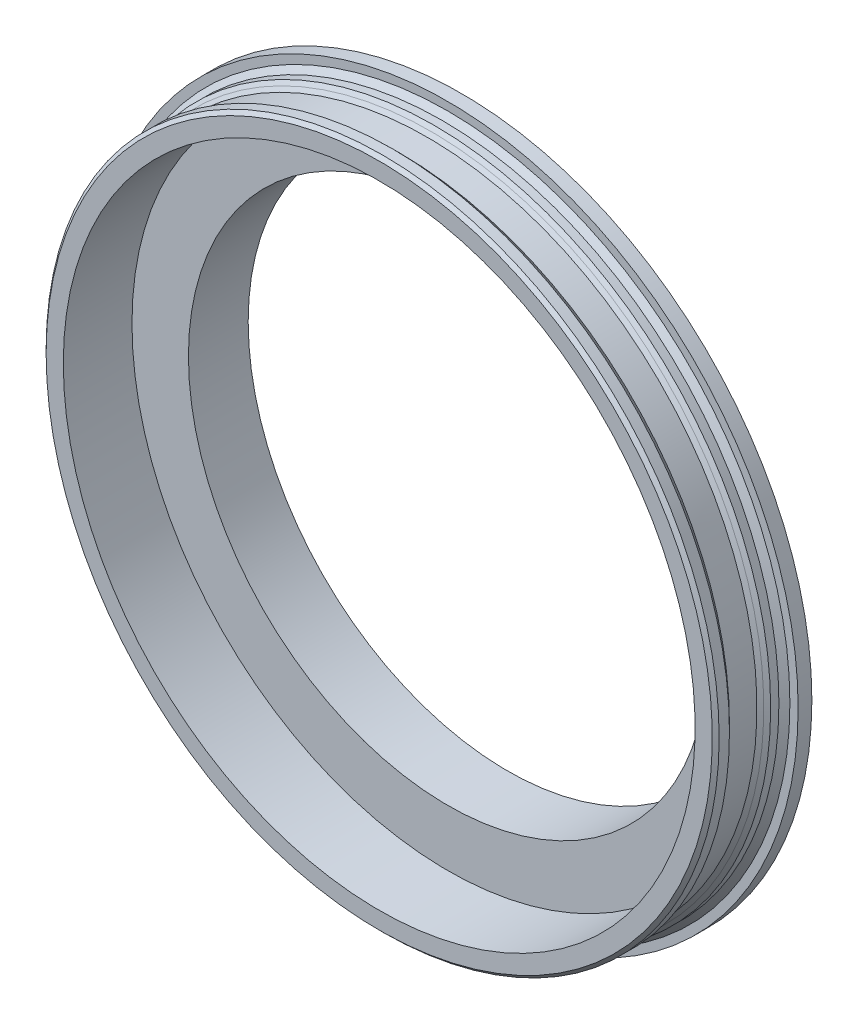
from build123d import *

# Parameters (mm, degrees)
CHAMFER1_SIZE = 0.5
CHAMFER2_SIZE = 0.8


with BuildPart() as part:
    # Sketch1 → Revolve1 (revolve)
    with BuildSketch(Plane(origin=(0, 0, 0), x_dir=(1, 0, 0), z_dir=(0, 1, 0)), mode=Mode.PRIVATE) as revolve1_sk:
        Polygon((37.78, 0), (37.78, -8.7), (46, -8.7), (46, -18.7), (49, -18.7), (49, -16.2), (48, -16.2), (48, -11.2), (49, -11.2), (49, -8.7), (51, -8.7), (51, -6.7), (39.78, -6.7), (39.78, 0), align=None)
    revolve(revolve1_sk.sketch.rotate(Axis((0, 0, -73.981367368), (0, 0, 1)), 180), axis=Axis((0, 0, -73.981367368), (0, 0, 1)))

    # Chamfer1
    chamfer1_edges = [part.edges().sort_by_distance(p)[0] for p in [
        (49, 0, 11.2),
        (48, 0, 11.2),
        (48, 0, 16.2),
        (49, 0, 16.2),
        (49, 0, 18.7),
        (39.78, 0, 0),
    ]]
    chamfer(chamfer1_edges, length=CHAMFER1_SIZE - 0.0001)  # a hair under: the kernel refuses the full size

    # Chamfer2
    chamfer2_edges = [part.edges().sort_by_distance(p)[0] for p in [
        (49, 0, 8.7),
    ]]
    chamfer(chamfer2_edges, length=CHAMFER2_SIZE)


solid = part.part
